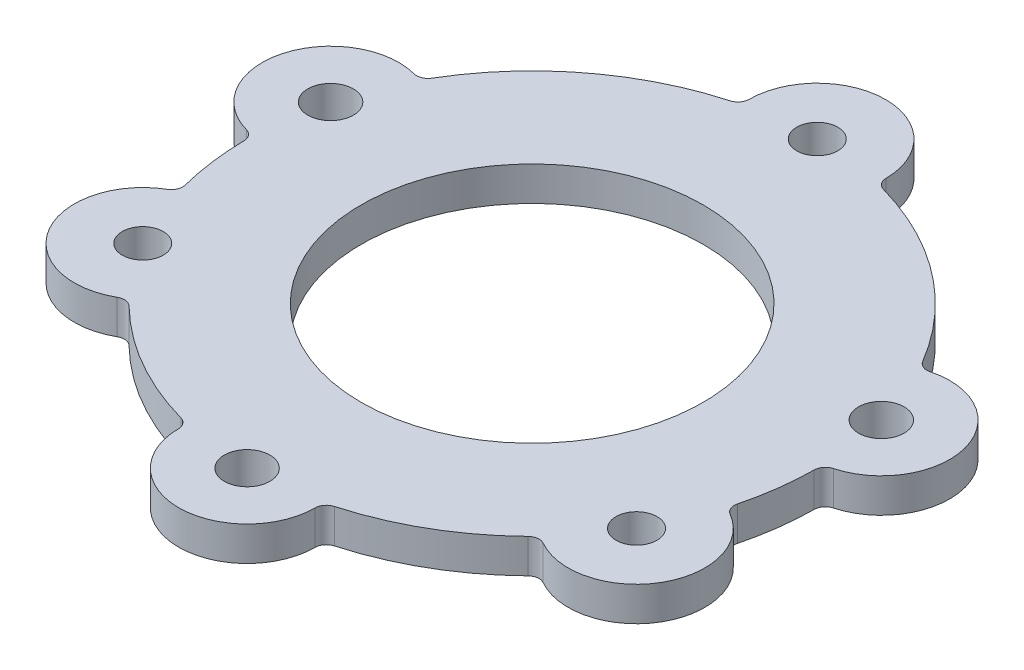
from build123d import *

# Parameters (mm, degrees)
SKETCH1_R           = 7.5
SKETCH1_R_2         = 1
SKETCH1_R_3         = 0.9
BOSS_EXTRUDE1_DEPTH = 1.5
FILLET1_R           = 0.5


with BuildPart() as part:
    # Sketch1 → Boss-Extrude1 (new body)
    with BuildSketch(Plane(origin=(0, 0, 0), x_dir=(1, 0, 0), z_dir=(0, 1, 0))):
        with BuildLine():
            ThreePointArc((10.944725414, 6.038458877), (7.609517863, 9.916916754), (3, 12.1346611))
            Line((3, 12.1346611), (3, 12.5))
            ThreePointArc((3, 12.5), (0, 15.5), (-3, 12.5))
            Line((-3, 12.5), (-3, 12.1346611))
            ThreePointArc((-3, 12.1346611), (-7.609517863, 9.916916754), (-10.944725414, 6.038458877))
            Line((-10.944725414, 6.038458877), (-11.297615693, 6.133015543))
            ThreePointArc((-11.297615693, 6.133015543), (-14.971850307, 4.011695199), (-12.850529964, 0.337460585))
            Line((-12.850529964, 0.337460585), (-12.497639685, 0.24290392))
            ThreePointArc((-12.497639685, 0.24290392), (-12.393060767, -1.631577403), (-12.008924778, -3.469254338))
            Line((-12.008924778, -3.469254338), (-12.325317547, -3.651923789))
            ThreePointArc((-12.325317547, -3.651923789), (-13.423393759, -7.75), (-9.325317547, -8.848076211))
            Line((-9.325317547, -8.848076211), (-9.008924778, -8.665406761))
            ThreePointArc((-9.008924778, -8.665406761), (-6.25, -10.825317547), (-3, -12.1346611))
            Line((-3, -12.1346611), (-3, -12.5))
            ThreePointArc((-3, -12.5), (0, -15.5), (3, -12.5))
            Line((3, -12.5), (3, -12.1346611))
            ThreePointArc((3, -12.1346611), (6.25, -10.825317547), (9.008924778, -8.665406761))
            Line((9.008924778, -8.665406761), (9.325317547, -8.848076211))
            ThreePointArc((9.325317547, -8.848076211), (13.423393759, -7.75), (12.325317547, -3.651923789))
            Line((12.325317547, -3.651923789), (12.008924778, -3.469254338))
            ThreePointArc((12.008924778, -3.469254338), (12.393060767, -1.631577403), (12.497639685, 0.24290392))
            Line((12.497639685, 0.24290392), (12.850529964, 0.337460585))
            ThreePointArc((12.850529964, 0.337460585), (14.971850307, 4.011695199), (11.297615693, 6.133015543))
            Line((11.297615693, 6.133015543), (10.944725414, 6.038458877))
        make_face()
        Circle(SKETCH1_R, mode=Mode.SUBTRACT)
        with Locations((12.074072829, 3.235238064)):
            Circle(SKETCH1_R_2, mode=Mode.SUBTRACT)
        with Locations((10.825317547, -6.25)):
            Circle(SKETCH1_R_3, mode=Mode.SUBTRACT)
        with Locations((0, 12.5)):
            Circle(SKETCH1_R_3, mode=Mode.SUBTRACT)
        with Locations((0, -12.5)):
            Circle(SKETCH1_R_2, mode=Mode.SUBTRACT)
        with Locations((-12.074072829, 3.235238064)):
            Circle(SKETCH1_R_2, mode=Mode.SUBTRACT)
        with Locations((-10.825317547, -6.25)):
            Circle(SKETCH1_R_3, mode=Mode.SUBTRACT)
    extrude(amount=BOSS_EXTRUDE1_DEPTH)

    # Fillet1
    fillet1_edges = [part.edges().sort_by_distance(p)[0] for p in [
        (-3, 0.75, 12.1346611),
        (3, 0.75, 12.1346611),
        (9.008924778, 0.75, 8.665406761),
        (12.008924778, 0.75, 3.469254338),
        (12.497639685, 0.75, -0.24290392),
        (10.944725414, 0.75, -6.038458877),
        (3, 0.75, -12.1346611),
        (-3, 0.75, -12.1346611),
        (-10.944725414, 0.75, -6.038458877),
        (-12.497639685, 0.75, -0.24290392),
        (-12.008924778, 0.75, 3.469254338),
        (-9.008924778, 0.75, 8.665406761),
    ]]
    fillet(fillet1_edges, radius=FILLET1_R)


solid = part.part
